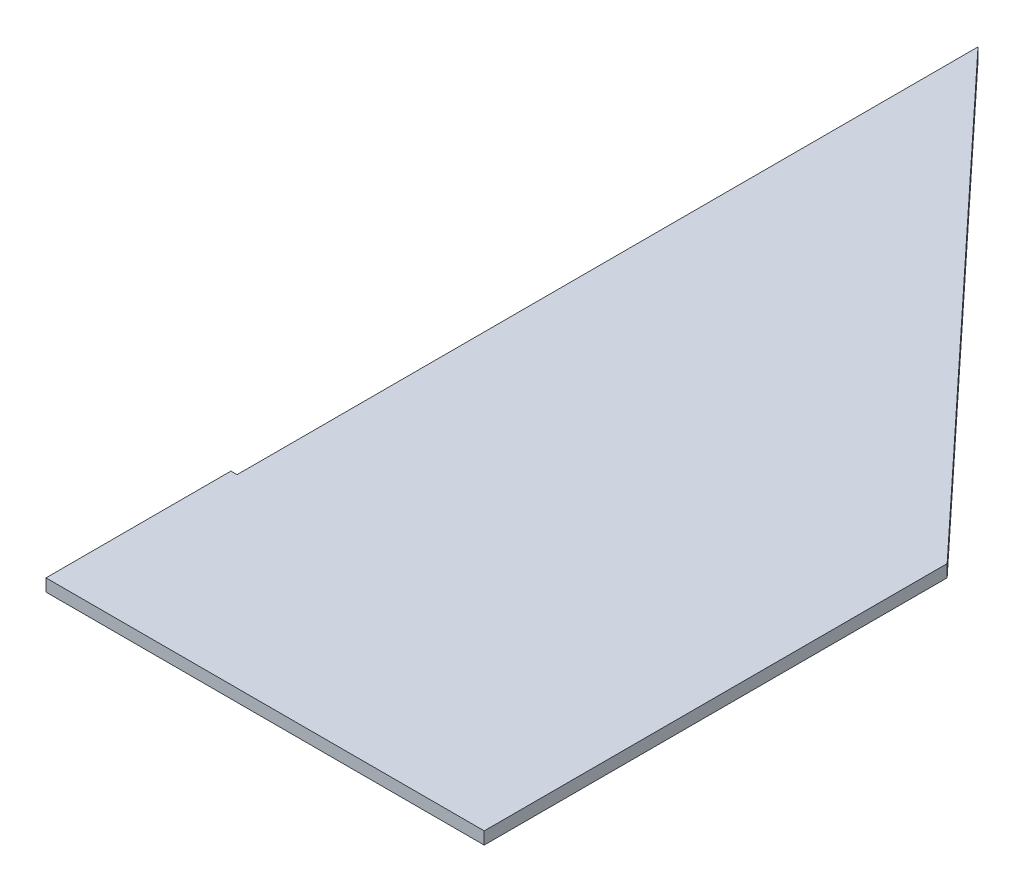
from build123d import *

# Parameters (mm, degrees)
ESTRUSIONE_ESTRUSIONE1_DEPTH      = 2
ESTRUSIONE_ESTRUSIONE1_DEPTH_BACK = 2


with BuildPart() as part:
    # Forma aletta → Estrusione-Estrusione1 (new, two sides: drawn at the far end of the back side and taken through both)
    with BuildSketch(Plane(origin=(0, 0, 0), x_dir=(1, 0, 0), z_dir=(0, 1, 0)).offset(-ESTRUSIONE_ESTRUSIONE1_DEPTH_BACK)):
        Polygon((0, 300), (0, 59.93), (-2, 59.93), (-2, 0), (0, 0), (140, 0), (140, 150), align=None)
    extrude(amount=ESTRUSIONE_ESTRUSIONE1_DEPTH + ESTRUSIONE_ESTRUSIONE1_DEPTH_BACK)


solid = part.part
